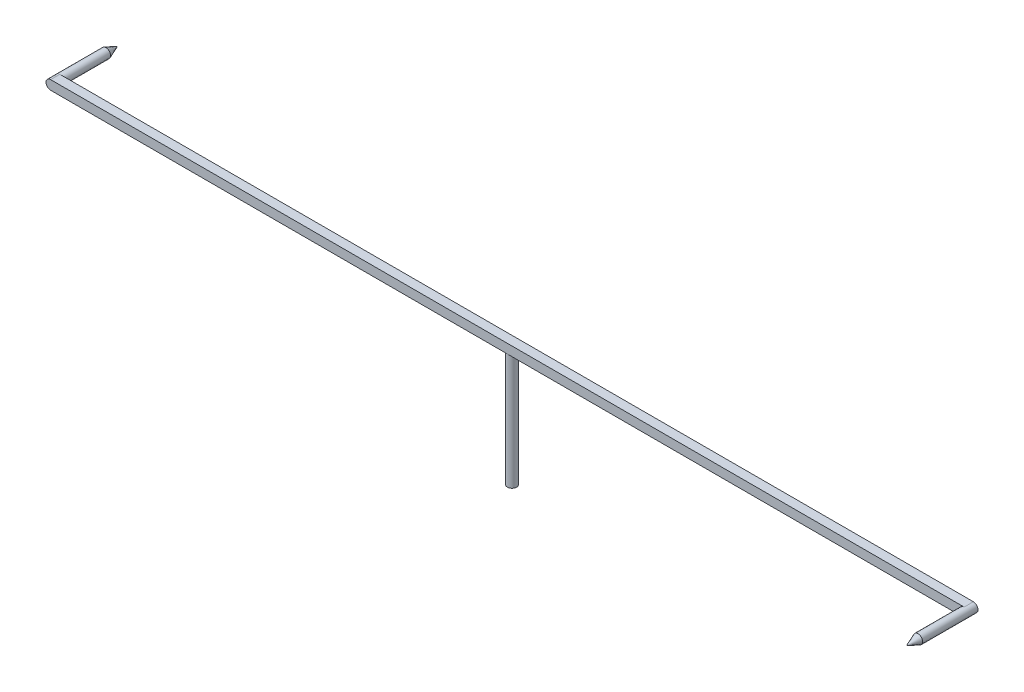
from build123d import *

# Parameters (mm, degrees)
SKETCH_1_R      = 0.4
EXTRUDE_1_DEPTH = 10
SKETCH_2_W      = 80
SKETCH_2_H      = 0.8
EXTRUDE_2_DEPTH = 0.8
FILLET_1_R      = 0.4
SKETCH_3_R      = 0.4
EXTRUDE_3_DEPTH = 4
SKETCH_4_R      = 0.4
EXTRUDE_4_DEPTH = 4


with BuildPart() as part:
    # 草图1 → 凸台-拉伸1 (new body)
    with BuildSketch(Plane(origin=(0, 0, 0), x_dir=(1, 0, 0), z_dir=(0, 1, 0))):
        with Locations(Location((0, 0, 0), (0, 0, 270))):
            Circle(SKETCH_1_R)
    extrude(amount=EXTRUDE_1_DEPTH)

    # 草图2 → 凸台-拉伸2 (add)
    with BuildSketch(Plane(origin=(0, 10, 0), x_dir=(1, 0, 0), z_dir=(0, 1, 0))):
        Rectangle(SKETCH_2_W, SKETCH_2_H)
    extrude(amount=EXTRUDE_2_DEPTH)

    # 圆角1
    fillet_1_edges = [part.edges().sort_by_distance(p)[0] for p in [
        (40, 10, 0),
        (40, 10.8, 0),
        (-40, 10, 0),
        (-40, 10.8, 0),
    ]]
    fillet(fillet_1_edges, radius=FILLET_1_R - 0.0001)  # a hair under: the kernel refuses the full size

    # 草图3 → 凸台-拉伸3 (add)
    with BuildSketch(Plane.XY.offset(0.4)):
        with Locations((39.6, 10.4)):
            Circle(SKETCH_3_R)
    extrude(amount=EXTRUDE_3_DEPTH)

    # 草图4 → 凸台-拉伸4 (add)
    with BuildSketch(Plane(origin=(0, 0, -0.4), x_dir=(-1, 0, 0), z_dir=(0, 0, -1))):
        with Locations((39.6, 10.4)):
            Circle(SKETCH_4_R)
    extrude(amount=EXTRUDE_4_DEPTH)

    # 草图5 → 旋转1 (revolve)
    with BuildSketch(Plane(origin=(0, 10.4, 0), x_dir=(1, 0, 0), z_dir=(0, 1, 0))):
        Polygon((39.6, -4.4), (39.6, -5.4), (40, -4.4), align=None)
    revolve(axis=Axis((39.6, 10.4, 4.4), (0, 0, 1)))

    # 草图6 → 旋转2 (revolve)
    with BuildSketch(Plane(origin=(0, 10.4, 0), x_dir=(1, 0, 0), z_dir=(0, 1, 0))):
        Polygon((-39.6, 4.4), (-39.6, 5.4), (-40, 4.4), align=None)
    revolve(axis=Axis((-39.6, 10.4, -4.4), (0, 0, -1)))


solid = part.part
